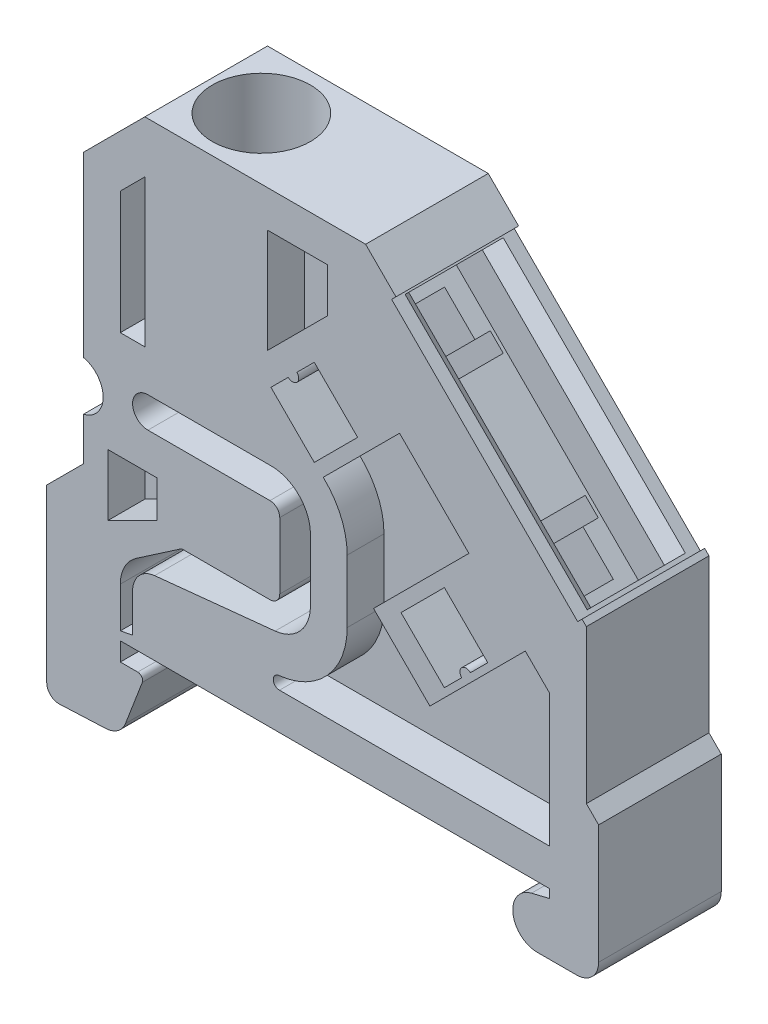
from build123d import *

# Parameters (mm, degrees)
BOSS_EXTRUDE1_DEPTH     = 5
CUT_EXTRUDE1_DEPTH      = 52.295711322
CUT_EXTRUDE1_DEPTH_BACK = 10
CUT_EXTRUDE3_START      = -10
CUT_EXTRUDE3_DEPTH      = 10
CUT_EXTRUDE4_DEPTH      = 52.295711322
CUT_EXTRUDE4_DEPTH_BACK = 10
CUT_EXTRUDE5_DEPTH      = 10
CUT_EXTRUDE6_DEPTH      = 3
SKETCH9_R               = 4
CUT_EXTRUDE7_DEPTH      = 13
CUT_EXTRUDE8_REACH      = 41.4
SKETCH10_R              = 1.75
CUT_EXTRUDE9_DEPTH      = 13
SKETCH12_W              = 6
SKETCH12_H              = 21
CUT_EXTRUDE10_DEPTH     = 4
CUT_EXTRUDE11_DEPTH     = 5.830271703
CHAMFER1_SIZE           = 1


# Read off the part's stored shape, not the designer's step: Cut-Extrude3
with BuildPart() as part:
    # Sketch1 → Boss-Extrude1 (new, symmetric)
    with BuildSketch(Plane.XY):
        Polygon((-22.5, 45), (-22.5, 0), (22.5, 0), (22.5, 26), (3.5, 45), align=None)
    extrude(amount=BOSS_EXTRUDE1_DEPTH, both=True)

    # Sketch2 → Cut-Extrude1 (cut, two sides: drawn at the far end of the back side and taken through both)
    with BuildSketch(Plane.XY.offset(5).offset(-CUT_EXTRUDE1_DEPTH_BACK)):
        with BuildLine():
            Line((-111.960387508, -74.460387508), (-22.5, 15))
            Line((-22.5, 15), (-19.5, 18))
            Line((-19.5, 18), (-19.5, 21.5))
            ThreePointArc((-19.5, 21.5), (-17.9, 23.5), (-19.5, 25.5))
            Line((-19.5, 25.5), (-19.5, 40))
            Line((-19.5, 40), (-14.5, 45))
            Line((-14.5, 45), (74.960387508, 134.460387508))
            Line((74.960387508, 134.460387508), (-113.613392046, 303.176768247))
            Line((-113.613392046, 303.176768247), (-300.534167062, 94.255993231))
            Line((-300.534167062, 94.255993231), (-111.960387508, -74.460387508))
        make_face()
    extrude(amount=CUT_EXTRUDE1_DEPTH + CUT_EXTRUDE1_DEPTH_BACK, mode=Mode.SUBTRACT)

    # Cut-Extrude3 outline → Cut-Extrude3 (cut)
    with BuildSketch(Plane.XY.offset(5).offset(CUT_EXTRUDE3_START)):
        Polygon((21.5, 27), (21.5, 14.5), (22.5, 13.5), (22.5, 26), align=None)
        with BuildLine():
            Line((22.5, 0), (22.5, 3.8))
            ThreePointArc((22.5, 3.8), (21.972792206, 2.527207794), (20.7, 2))
            Line((20.7, 2), (17.5, 2))
            ThreePointArc((17.5, 2), (15.514097811, 3.762950432), (17.029242744, 5.943807502))
            Line((17.029242744, 5.943807502), (18.5, 6.3))
            Line((18.5, 6.3), (18.5, 7))
            Line((18.5, 7), (-16.5, 7))
            Line((-16.5, 7), (-16.5, 5.5))
            Line((-16.5, 5.5), (-15.081081244, 5.5))
            ThreePointArc((-15.081081244, 5.5), (-14.751598645, 5.326806563), (-14.707437165, 4.957206084))
            Line((-14.707437165, 4.957206084), (-16.078389668, 1.369880369))
            ThreePointArc((-16.078389668, 1.369880369), (-16.706486271, 0.552810765), (-17.679866918, 0.214228137))
            Line((-17.679866918, 0.214228137), (-21.455599386, 0.046417805))
            ThreePointArc((-21.455599386, 0.046417805), (-22.191230564, 0.322797329), (-22.5, 1.045431612))
            Line((-22.5, 1.045431612), (-22.5, 0))
            Line((-22.5, 0), (22.5, 0))
        make_face()
    extrude(amount=CUT_EXTRUDE3_DEPTH, mode=Mode.SUBTRACT)

    # Sketch3 → Cut-Extrude4 (cut, two sides: drawn at the far end of the back side and taken through both)
    with BuildSketch(Plane.XY.offset(5).offset(-CUT_EXTRUDE4_DEPTH_BACK)):
        Polygon((85.857284299, 122.40753683), (5.974873734, 42.525126266), (5.621320344, 42.171572875), (20.792893219, 27), (21.146446609, 27.353553391), (101.028857174, 107.235963955), (260.793678303, 267.000785084), (245.622105428, 282.17235796), align=None)
    extrude(amount=CUT_EXTRUDE4_DEPTH + CUT_EXTRUDE4_DEPTH_BACK, mode=Mode.SUBTRACT)

    # Sketch7 → Cut-Extrude5 (cut)
    with BuildSketch(Plane.XY.offset(5)):
        with BuildLine():
            Line((-16.5, 7.7), (-16.5, 11))
            ThreePointArc((-16.5, 11), (-16.153059775, 12.400454865), (-15.192484115, 13.476993646))
            Line((-15.192484115, 13.476993646), (-11.5, 16))
            Line((-11.5, 16), (-4.3, 16))
            ThreePointArc((-4.3, 16), (-3.734314575, 16.234314575), (-3.5, 16.8))
            Line((-3.5, 16.8), (-3.5, 22.2))
            ThreePointArc((-3.5, 22.2), (-3.734314575, 22.765685425), (-4.3, 23))
            Line((-4.3, 23), (-14.25, 23))
            ThreePointArc((-14.25, 23), (-15.5, 24.25), (-14.25, 25.5))
            Line((-14.25, 25.5), (-4.2, 25.5))
            ThreePointArc((-4.2, 25.5), (-1.9372583, 24.5627417), (-1, 22.3))
            Line((-1, 22.3), (-1, 17.183557492))
            ThreePointArc((-1, 17.183557492), (-1.825475903, 15.038415232), (-3.876022072, 14))
            Line((-3.876022072, 14), (-13.702486205, 13))
            ThreePointArc((-13.702486205, 13), (-14.98407756, 12.35099048), (-15.5, 11.010276568))
            Line((-15.5, 11.010276568), (-15.5, 7.9))
            Line((-15.5, 7.9), (-16.5, 7.7))
        make_face()
    extrude(amount=-CUT_EXTRUDE5_DEPTH, mode=Mode.SUBTRACT)

    # Sketch8 → Cut-Extrude6 (cut)
    with BuildSketch(Plane.XY.offset(5)):
        Polygon((-17.5, 20), (-13.5, 20), (-13.5, 17), (-17.5, 15), align=None)
        Polygon((-16.5, 38.757359313), (-16.5, 28.757359313), (-14.5, 28.757359313), (-14.5, 40.757359313), align=None)
        Polygon((0.4, 42), (-4.5, 42), (-4.5, 33.5), (0.4, 38.4), align=None)
        with BuildLine():
            Line((-3.52075849, 10), (18.5, 10))
            Line((18.5, 10), (18.5, 20.807611845))
            Line((18.5, 20.807611845), (16.520101013, 22.787510832))
            Line((16.520101013, 22.787510832), (8.74192642, 15.009336239))
            Line((8.74192642, 15.009336239), (4.145732342, 19.605530317))
            Line((4.145732342, 19.605530317), (11.923906935, 27.38370491))
            Line((11.923906935, 27.38370491), (6.267052685, 33.040559159))
            Line((6.267052685, 33.040559159), (0.045175397, 26.818681871))
            ThreePointArc((0.045175397, 26.818681871), (1.490346539, 24.761697843), (2, 22.3))
            Line((2, 22.3), (2, 17.183557492))
            ThreePointArc((2, 17.183557492), (0.400640437, 13.027344363), (-3.572292764, 11.015414852))
            ThreePointArc((-3.572292764, 11.015414852), (-4.029119362, 10.483214857), (-3.52075849, 10))
        make_face()
    cut_extrude6 = extrude(amount=-CUT_EXTRUDE6_DEPTH, mode=Mode.SUBTRACT)

    # Mirror1: Cut-Extrude6 across plane
    add(cut_extrude6.mirror(Plane.XY), mode=Mode.SUBTRACT)

    # Sketch9 → Cut-Extrude7 (cut)
    with BuildSketch(Plane(origin=(0, 45, 0), x_dir=(1, 0, 0), z_dir=(0, 1, 0))):
        with Locations(Location((-10, 0, 0), (0, 0, 270))):
            Circle(SKETCH9_R)
    extrude(amount=-CUT_EXTRUDE7_DEPTH, mode=Mode.SUBTRACT)

    # Cut-Extrude8: up to this face of the body (flat: up to its plane)
    cut_extrude8_end = Plane(part.part.faces().sort_by_distance((-7.9, 16, 0))[0])
    # Sketch10 → Cut-Extrude8 (cut, up to the picked face)
    with BuildSketch(Plane(origin=(0, 32, 0), x_dir=(1, 0, 0), z_dir=(0, 1, 0)), mode=Mode.PRIVATE) as cut_extrude8_sk1:
        with Locations(Location((-10, 0, 0), (0, 0, 270))):
            Circle(SKETCH10_R)
    cut_extrude8_tool1 = split(extrude(cut_extrude8_sk1.sketch, amount=-CUT_EXTRUDE8_REACH, mode=Mode.PRIVATE), bisect_by=cut_extrude8_end, keep=Keep.BOTH, mode=Mode.PRIVATE)
    add(cut_extrude8_tool1.solids().sort_by(Axis((-10, 32, 0), (0, -1, 0)))[0], mode=Mode.SUBTRACT)

    # Sketch11 → Cut-Extrude9 (cut)
    with BuildSketch(Plane.XY.offset(5)):
        with BuildLine():
            Line((-4.219533003, 31.039254845), (-0.683999097, 27.503720939))
            Line((-0.683999097, 27.503720939), (2.851534809, 31.039254845))
            Line((2.851534809, 31.039254845), (-0.683999097, 34.574788751))
            Line((-0.683999097, 34.574788751), (-2.098212659, 33.160575189))
            ThreePointArc((-2.098212659, 33.160575189), (-2.098212659, 32.453468408), (-2.80531944, 32.453468408))
            Line((-2.80531944, 32.453468408), (-4.219533003, 31.039254845))
        make_face()
        with BuildLine():
            Line((11.336816184, 18.311332784), (9.922602621, 16.897119222))
            Line((9.922602621, 16.897119222), (6.387068715, 20.432653128))
            Line((6.387068715, 20.432653128), (9.922602621, 23.968187033))
            Line((9.922602621, 23.968187033), (13.458136527, 20.432653128))
            Line((13.458136527, 20.432653128), (12.043922965, 19.018439565))
            ThreePointArc((12.043922965, 19.018439565), (11.336816184, 19.018439565), (11.336816184, 18.311332784))
        make_face()
    extrude(amount=-CUT_EXTRUDE9_DEPTH, mode=Mode.SUBTRACT)

    # Sketch12 → Cut-Extrude10 (cut)
    with BuildSketch(Plane(origin=(23.896446609, 23.896446609, 0), x_dir=(0, 0, -1), z_dir=(0.7071067811865471, 0.7071067811865479, 0))):
        with Locations((0, 15.204222165)):
            Rectangle(SKETCH12_W, SKETCH12_H)
    extrude(amount=-CUT_EXTRUDE10_DEPTH, mode=Mode.SUBTRACT)

    # Sketch13 → Cut-Extrude11 (cut)
    with BuildSketch(Plane(origin=(21.068019485, 21.068019485, 0), x_dir=(0, 0, -1), z_dir=(0.7071067811865471, 0.7071067811865479, 0))):
        Polygon((-1.5, 24.931727984), (1.5, 24.931727984), (1.5, 21.431727984), (2.75, 21.431727984), (2.75, 19.931727984), (-2.75, 19.931727984), (-2.75, 21.431727984), (-1.5, 21.431727984), align=None)
        Polygon((-1.5, 5.476716347), (-1.5, 8.976716347), (-2.75, 8.976716347), (-2.75, 10.476716347), (2.75, 10.476716347), (2.75, 8.976716347), (1.5, 8.976716347), (1.5, 5.476716347), align=None)
    extrude(amount=-CUT_EXTRUDE11_DEPTH, mode=Mode.SUBTRACT)

    # Chamfer1
    chamfer1_edges = [part.edges().sort_by_distance(p)[0] for p in [
        (13.145438014, 34.647455205, -3),
        (13.145438014, 34.647455205, 3),
    ]]
    chamfer(chamfer1_edges, length=CHAMFER1_SIZE)


solid = part.part
